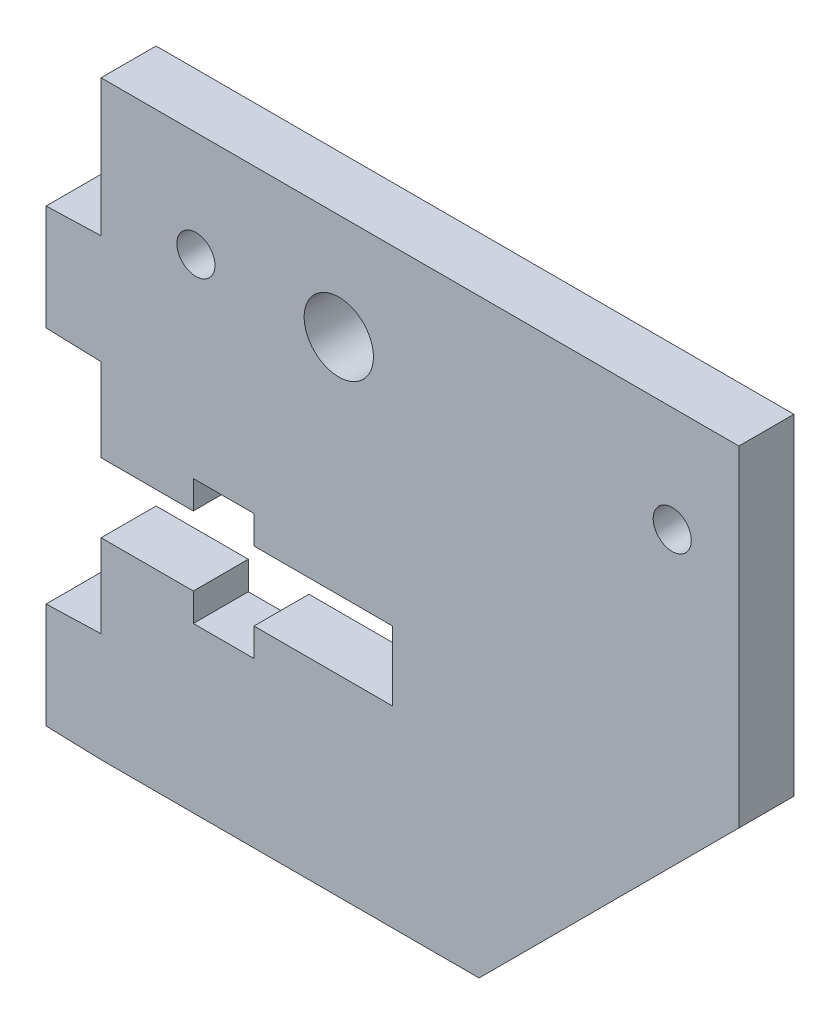
from build123d import *

# Parameters (mm, degrees)
SKETCH1_R           = 2
SKETCH1_R_2         = 1.1
BOSS_EXTRUDE1_DEPTH = 3.175
CHAMFER1_SIZE       = 15


with BuildPart() as part:
    # Sketch1 → Boss-Extrude1 (new body)
    with BuildSketch(Plane.XY):
        Polygon((3.175, 34), (3.175, 26.1), (0, 26), (0, 19.9), (3.175, 19.8), (3.175, 15), (8.5, 15), (8.5, 16.625), (12, 16.625), (12, 15), (20, 15), (20, 11), (12, 11), (12, 9.375), (8.5, 9.375), (8.5, 11), (3.175, 11), (3.175, 6.2), (0, 6.1), (0, 0), (3.175, -0.1), (40, -0.1), (40, 34), align=None)
        with Locations((16.9, 27.9)):
            Circle(SKETCH1_R, mode=Mode.SUBTRACT)
        with Locations((8.65, 27.9)):
            Circle(SKETCH1_R_2, mode=Mode.SUBTRACT)
        with Locations((36.15, 27.9)):
            Circle(SKETCH1_R_2, mode=Mode.SUBTRACT)
    extrude(amount=BOSS_EXTRUDE1_DEPTH)

    # Chamfer1
    chamfer1_edges = [part.edges().sort_by_distance(p)[0] for p in [
        (40, -0.1, 1.5875),
    ]]
    chamfer(chamfer1_edges, length=CHAMFER1_SIZE)


solid = part.part
